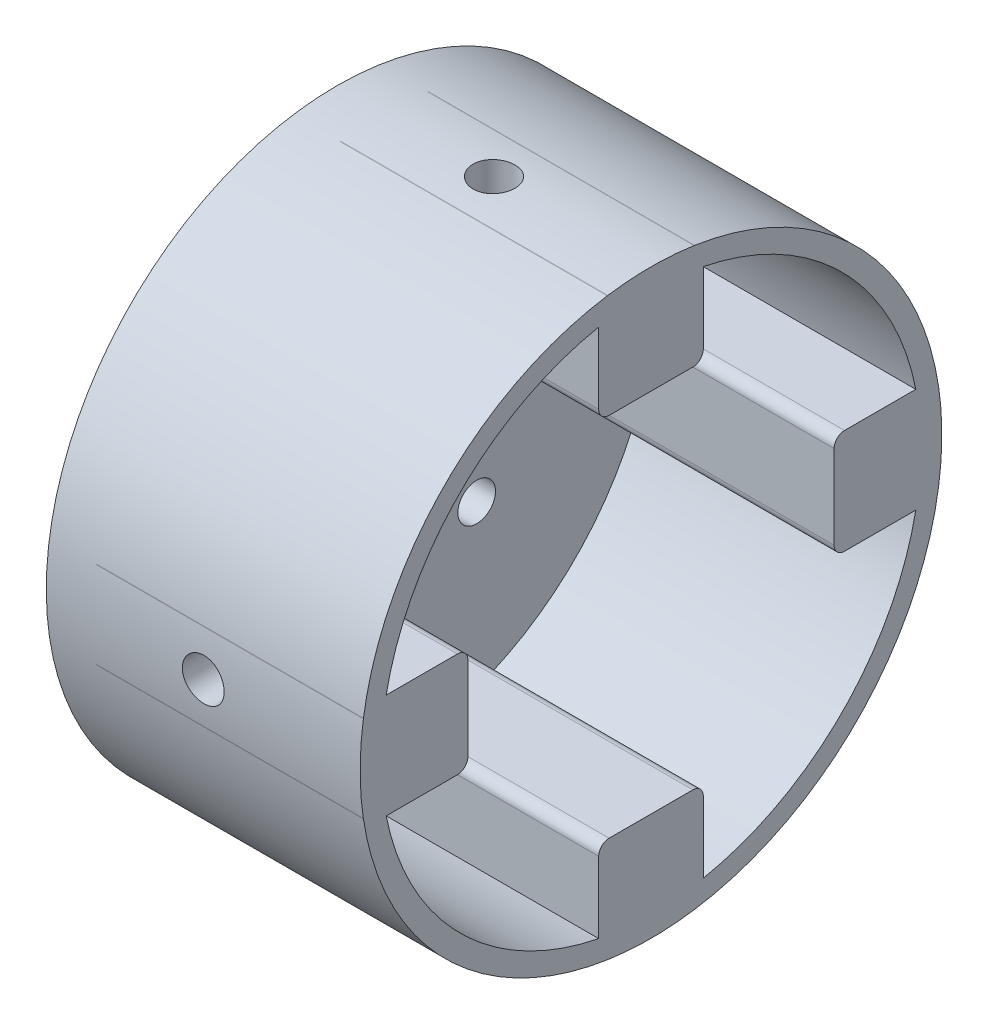
from build123d import *

# Parameters (mm, degrees)
BOSS_EXTRUDE1_DEPTH = 25.5
SKETCH3_R           = 1.8
CUT_EXTRUDE1_DEPTH  = 4.5
SKETCH4_R           = 4
CUT_EXTRUDE2_DEPTH  = 2
SKETCH5_W           = 6
SKETCH5_H           = 25
CUT_EXTRUDE3_DEPTH  = 2
SKETCH6_R           = 2
CUT_EXTRUDE4_DEPTH  = 7
CUT_EXTRUDE5_START  = 7
SKETCH7_R           = 2
CUT_EXTRUDE5_DEPTH  = 7
SKETCH8_R           = 2
CUT_EXTRUDE6_DEPTH  = 7
CUT_EXTRUDE7_START  = 7
SKETCH9_R           = 2
CUT_EXTRUDE7_DEPTH  = 7


with BuildPart() as part:
    # Sketch1 → Revolve1 (revolve)
    with BuildSketch(Plane.XY):
        Polygon((0, 0), (0, 27.8), (30, 27.8), (30, 25.8), (4.5, 25.8), (4.5, 0), align=None)
    revolve(axis=Axis((-10, 0, 0), (1, 0, 0)))

    # Sketch2 → Boss-Extrude1 (add)
    with BuildSketch(Plane(origin=(4.5, 0, 0), x_dir=(0, 0, -1), z_dir=(1, 0, 0))):
        with BuildLine():
            Line((-4, 17.5), (4, 17.5))
            ThreePointArc((4, 17.5), (4.707106781, 17.792893219), (5, 18.5))
            Line((5, 18.5), (5, 26.5))
            ThreePointArc((5, 26.5), (4.707106781, 27.207106781), (4, 27.5))
            Line((4, 27.5), (-4, 27.5))
            ThreePointArc((-4, 27.5), (-4.707106781, 27.207106781), (-5, 26.5))
            Line((-5, 26.5), (-5, 18.5))
            ThreePointArc((-5, 18.5), (-4.707106781, 17.792893219), (-4, 17.5))
        make_face()
        with BuildLine():
            Line((-4, -27.5), (4, -27.5))
            ThreePointArc((4, -27.5), (4.707106781, -27.207106781), (5, -26.5))
            Line((5, -26.5), (5, -18.5))
            ThreePointArc((5, -18.5), (4.707106781, -17.792893219), (4, -17.5))
            Line((4, -17.5), (-4, -17.5))
            ThreePointArc((-4, -17.5), (-4.707106781, -17.792893219), (-5, -18.5))
            Line((-5, -18.5), (-5, -26.5))
            ThreePointArc((-5, -26.5), (-4.707106781, -27.207106781), (-4, -27.5))
        make_face()
        with BuildLine():
            Line((-26.5, -5), (-18.5, -5))
            ThreePointArc((-18.5, -5), (-17.792893219, -4.707106781), (-17.5, -4))
            Line((-17.5, -4), (-17.5, 4))
            ThreePointArc((-17.5, 4), (-17.792893219, 4.707106781), (-18.5, 5))
            Line((-18.5, 5), (-26.5, 5))
            ThreePointArc((-26.5, 5), (-27.207106781, 4.707106781), (-27.5, 4))
            Line((-27.5, 4), (-27.5, -4))
            ThreePointArc((-27.5, -4), (-27.207106781, -4.707106781), (-26.5, -5))
        make_face()
        with BuildLine():
            Line((18.5, -5), (26.5, -5))
            ThreePointArc((26.5, -5), (27.207106781, -4.707106781), (27.5, -4))
            Line((27.5, -4), (27.5, 4))
            ThreePointArc((27.5, 4), (27.207106781, 4.707106781), (26.5, 5))
            Line((26.5, 5), (18.5, 5))
            ThreePointArc((18.5, 5), (17.792893219, 4.707106781), (17.5, 4))
            Line((17.5, 4), (17.5, -4))
            ThreePointArc((17.5, -4), (17.792893219, -4.707106781), (18.5, -5))
        make_face()
    extrude(amount=BOSS_EXTRUDE1_DEPTH)

    # Sketch3 → Cut-Extrude1 (cut)
    with BuildSketch(Plane(origin=(0, 0, 0), x_dir=(0, 0, -1), z_dir=(1, 0, 0))):
        with Locations((-8.84, 8.84)):
            Circle(SKETCH3_R)
        with Locations((-8.84, -8.84)):
            Circle(SKETCH3_R)
        with Locations((8.84, 8.84)):
            Circle(SKETCH3_R)
        with Locations((8.84, -8.84)):
            Circle(SKETCH3_R)
    extrude(amount=CUT_EXTRUDE1_DEPTH, mode=Mode.SUBTRACT)

    # Sketch4 → Cut-Extrude2 (cut)
    with BuildSketch(Plane(origin=(0, 0, 0), x_dir=(0, 0, -1), z_dir=(1, 0, 0))):
        Circle(SKETCH4_R)
    extrude(amount=CUT_EXTRUDE2_DEPTH, mode=Mode.SUBTRACT)

    # Sketch5 → Cut-Extrude3 (cut)
    with BuildSketch(Plane(origin=(0, 0, 0), x_dir=(0, 0, -1), z_dir=(1, 0, 0))):
        with Locations((0, -15.5)):
            Rectangle(SKETCH5_W, SKETCH5_H)
    extrude(amount=CUT_EXTRUDE3_DEPTH, mode=Mode.SUBTRACT)

    # Sketch6 → Cut-Extrude4 (cut)
    with BuildSketch(Plane(origin=(0, 27.8, 0), x_dir=(1, 0, 0), z_dir=(0, 1, 0))):
        with Locations((15, 0)):
            Circle(SKETCH6_R)
    extrude(amount=-CUT_EXTRUDE4_DEPTH, mode=Mode.SUBTRACT)

    # Sketch7 → Cut-Extrude5 (cut)
    with BuildSketch(Plane(origin=(0, -27.8, 0), x_dir=(1, 0, 0), z_dir=(0, 1, 0)).offset(CUT_EXTRUDE5_START)):
        with Locations((15, 0)):
            Circle(SKETCH7_R)
    extrude(amount=-CUT_EXTRUDE5_DEPTH, mode=Mode.SUBTRACT)

    # Sketch8 → Cut-Extrude6 (cut)
    with BuildSketch(Plane.XY.offset(27.8)):
        with Locations((15, 0)):
            Circle(SKETCH8_R)
    extrude(amount=-CUT_EXTRUDE6_DEPTH, mode=Mode.SUBTRACT)

    # Sketch9 → Cut-Extrude7 (cut)
    with BuildSketch(Plane.XY.offset(-27.8).offset(CUT_EXTRUDE7_START)):
        with Locations((15, 0)):
            Circle(SKETCH9_R)
    extrude(amount=-CUT_EXTRUDE7_DEPTH, mode=Mode.SUBTRACT)


solid = part.part
